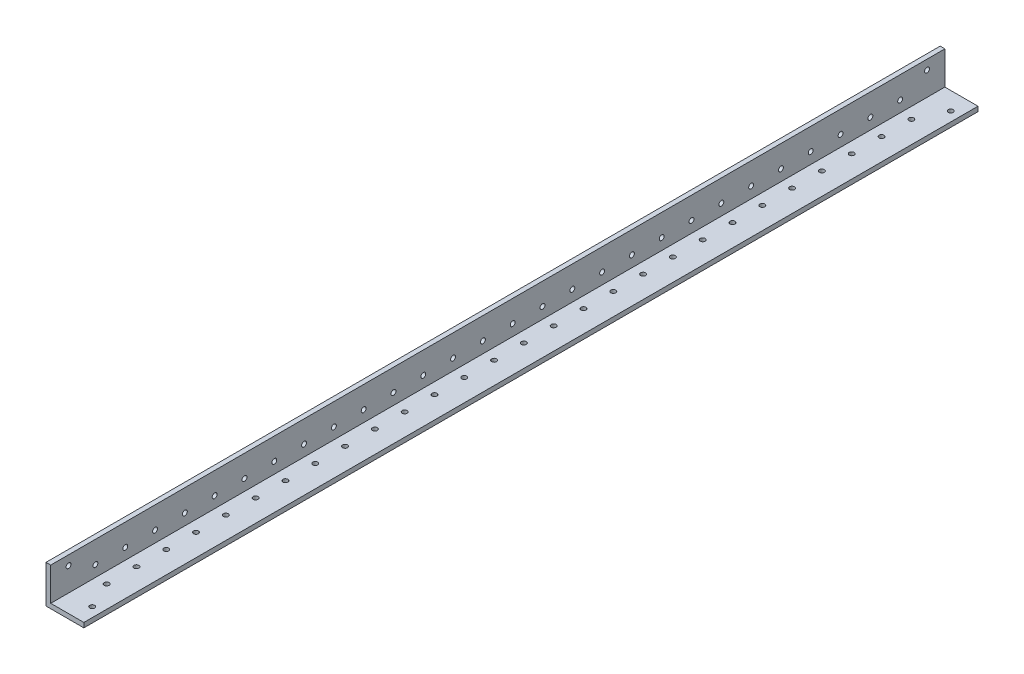
from build123d import *

# Parameters (mm, degrees)
BOSS_EXTRUDE1_DEPTH = 1219.2
FILLET1_R           = 0.4064
SKETCH4_W           = 1838.4
SKETCH4_H           = 103.278519729
CUT_EXTRUDE1_DEPTH  = 60
SKETCH5_W           = 2.838427027
SKETCH5_H           = 1.970979722
CUT_EXTRUDE2_DEPTH  = 700
SKETCH9_R           = 1.65
CUT_EXTRUDE5_DEPTH  = 20
SKETCH10_R          = 1.65
CUT_EXTRUDE6_DEPTH  = 20
SKETCH11_R          = 1.65
CUT_EXTRUDE7_DEPTH  = 70
SKETCH12_R          = 1.65
CUT_EXTRUDE8_DEPTH  = 70


with BuildPart() as part:
    # Sketch3 → Boss-Extrude1 (new, symmetric)
    with BuildSketch(Plane.XY):
        Polygon((3.175, 25.4), (0, 25.4), (0, 0), (25.4, 0), (25.4, 3.175), (3.175, 3.175), align=None)
    extrude(amount=BOSS_EXTRUDE1_DEPTH, both=True)

    # Fillet1
    fillet1_edges = [part.edges().sort_by_distance(p)[0] for p in [
        (3.175, 3.175, 0),
    ]]
    fillet(fillet1_edges, radius=FILLET1_R)

    # Sketch4 → Cut-Extrude1 (cut)
    with BuildSketch(Plane.ZY):
        with Locations((-300, -26.239259864)):
            Rectangle(SKETCH4_W, SKETCH4_H)
    extrude(amount=-CUT_EXTRUDE1_DEPTH, mode=Mode.SUBTRACT)

    # Sketch5 → Cut-Extrude2 (cut)
    with BuildSketch(Plane(origin=(0, 0, 619.2), x_dir=(-1, 0, 0), z_dir=(0, 0, -1))):
        with Locations((-4.594213514, 4.160489861)):
            Rectangle(SKETCH5_W, SKETCH5_H)
    extrude(amount=-CUT_EXTRUDE2_DEPTH, mode=Mode.SUBTRACT)

    # Sketch9 → Cut-Extrude5 (cut)
    with BuildSketch(Plane(origin=(3.175, 0, 0), x_dir=(0, 0, -1), z_dir=(1, 0, 0))):
        with Locations((-649.2, 10.675)):
            Circle(SKETCH9_R)
        with Locations((-669.2, 10.675)):
            Circle(SKETCH9_R)
        with Locations((-689.2, 10.675)):
            Circle(SKETCH9_R)
        with Locations((-709.2, 10.675)):
            Circle(SKETCH9_R)
        with Locations((-729.2, 10.675)):
            Circle(SKETCH9_R)
        with Locations((-749.2, 10.675)):
            Circle(SKETCH9_R)
        with Locations((-769.2, 10.675)):
            Circle(SKETCH9_R)
        with Locations((-789.2, 10.675)):
            Circle(SKETCH9_R)
        with Locations((-809.2, 10.675)):
            Circle(SKETCH9_R)
        with Locations((-829.2, 10.675)):
            Circle(SKETCH9_R)
        with Locations((-849.2, 10.675)):
            Circle(SKETCH9_R)
        with Locations((-869.2, 10.675)):
            Circle(SKETCH9_R)
        with Locations((-889.2, 10.675)):
            Circle(SKETCH9_R)
        with Locations((-909.2, 10.675)):
            Circle(SKETCH9_R)
        with Locations((-929.2, 10.675)):
            Circle(SKETCH9_R)
        with Locations((-949.2, 10.675)):
            Circle(SKETCH9_R)
        with Locations((-969.2, 10.675)):
            Circle(SKETCH9_R)
        with Locations((-989.2, 10.675)):
            Circle(SKETCH9_R)
        with Locations((-1009.2, 10.675)):
            Circle(SKETCH9_R)
        with Locations((-1029.2, 10.675)):
            Circle(SKETCH9_R)
        with Locations((-1049.2, 10.675)):
            Circle(SKETCH9_R)
        with Locations((-1069.2, 10.675)):
            Circle(SKETCH9_R)
        with Locations((-1089.2, 10.675)):
            Circle(SKETCH9_R)
        with Locations((-1109.2, 10.675)):
            Circle(SKETCH9_R)
        with Locations((-1129.2, 10.675)):
            Circle(SKETCH9_R)
        with Locations((-1149.2, 10.675)):
            Circle(SKETCH9_R)
        with Locations((-1169.2, 10.675)):
            Circle(SKETCH9_R)
        with Locations((-1189.2, 10.675)):
            Circle(SKETCH9_R)
    extrude(amount=-CUT_EXTRUDE5_DEPTH, mode=Mode.SUBTRACT)

    # Sketch10 → Cut-Extrude6 (cut)
    with BuildSketch(Plane(origin=(0, 3.175, 0), x_dir=(1, 0, 0), z_dir=(0, 1, 0))):
        with Locations((10.675, -649.2)):
            Circle(SKETCH10_R)
        with Locations((10.675, -669.2)):
            Circle(SKETCH10_R)
        with Locations((10.675, -689.2)):
            Circle(SKETCH10_R)
        with Locations((10.675, -709.2)):
            Circle(SKETCH10_R)
        with Locations((10.675, -729.2)):
            Circle(SKETCH10_R)
        with Locations((10.675, -749.2)):
            Circle(SKETCH10_R)
        with Locations((10.675, -769.2)):
            Circle(SKETCH10_R)
        with Locations((10.675, -789.2)):
            Circle(SKETCH10_R)
        with Locations((10.675, -809.2)):
            Circle(SKETCH10_R)
        with Locations((10.675, -829.2)):
            Circle(SKETCH10_R)
        with Locations((10.675, -849.2)):
            Circle(SKETCH10_R)
        with Locations((10.675, -869.2)):
            Circle(SKETCH10_R)
        with Locations((10.675, -889.2)):
            Circle(SKETCH10_R)
        with Locations((10.675, -909.2)):
            Circle(SKETCH10_R)
        with Locations((10.675, -929.2)):
            Circle(SKETCH10_R)
        with Locations((10.675, -949.2)):
            Circle(SKETCH10_R)
        with Locations((10.675, -969.2)):
            Circle(SKETCH10_R)
        with Locations((10.675, -989.2)):
            Circle(SKETCH10_R)
        with Locations((10.675, -1009.2)):
            Circle(SKETCH10_R)
        with Locations((10.675, -1029.2)):
            Circle(SKETCH10_R)
        with Locations((10.675, -1049.2)):
            Circle(SKETCH10_R)
        with Locations((10.675, -1069.2)):
            Circle(SKETCH10_R)
        with Locations((10.675, -1089.2)):
            Circle(SKETCH10_R)
        with Locations((10.675, -1109.2)):
            Circle(SKETCH10_R)
        with Locations((10.675, -1129.2)):
            Circle(SKETCH10_R)
        with Locations((10.675, -1149.2)):
            Circle(SKETCH10_R)
        with Locations((10.675, -1169.2)):
            Circle(SKETCH10_R)
        with Locations((10.675, -1189.2)):
            Circle(SKETCH10_R)
    extrude(amount=-CUT_EXTRUDE6_DEPTH, mode=Mode.SUBTRACT)

    # Sketch11 → Cut-Extrude7 (cut)
    with BuildSketch(Plane(origin=(0, 3.175, 0), x_dir=(1, 0, 0), z_dir=(0, 1, 0))):
        with Locations((19.05, -1207.2366)):
            Circle(SKETCH11_R)
        with Locations((19.05, -631.1634)):
            Circle(SKETCH11_R)
    extrude(amount=-CUT_EXTRUDE7_DEPTH, mode=Mode.SUBTRACT)

    # Sketch12 → Cut-Extrude8 (cut)
    with BuildSketch(Plane(origin=(3.175, 0, 0), x_dir=(0, 0, -1), z_dir=(1, 0, 0))):
        with Locations((-1207.2366, 19.05)):
            Circle(SKETCH12_R)
        with Locations((-631.1634, 19.05)):
            Circle(SKETCH12_R)
    extrude(amount=-CUT_EXTRUDE8_DEPTH, mode=Mode.SUBTRACT)


solid = part.part
